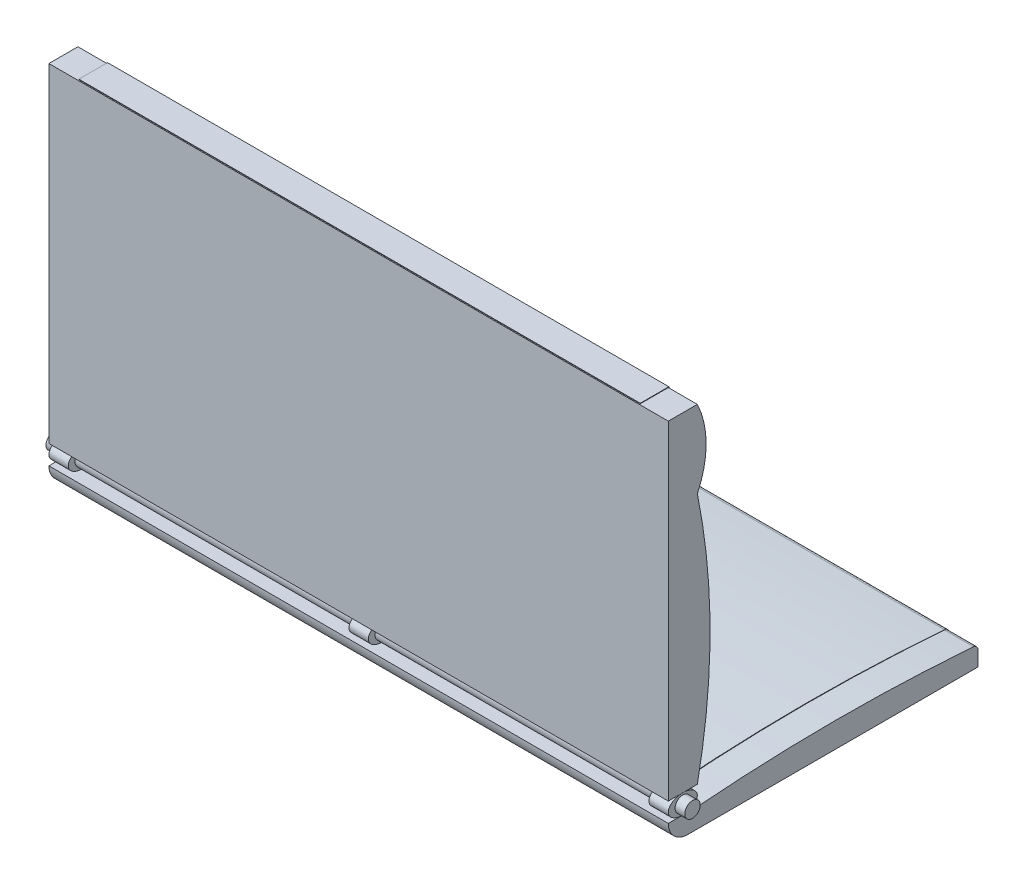
from build123d import *

# Parameters (mm, degrees)
SKETCH2_W            = 812.8
SKETCH2_H            = 406.4
BOSS_EXTRUDE1_DEPTH  = 25.4
BOSS_EXTRUDE2_START  = 25.4
SKETCH3_W            = 812.8
SKETCH3_H            = 38.1
BOSS_EXTRUDE2_DEPTH  = 431.8
SKETCH4_RX           = 19.05
SKETCH4_RY           = 12.7
BOSS_EXTRUDE3_DEPTH  = 25.4
SKETCH6_RX           = 19.05
SKETCH6_RY           = 12.7
BOSS_EXTRUDE4_DEPTH  = 25.4
BOSS_EXTRUDE5_START  = -419.1
SKETCH7_RX           = 19.05
SKETCH7_RY           = 12.7
BOSS_EXTRUDE5_DEPTH  = 25.4
BOSS_EXTRUDE6_START  = 12.7
SKETCH8_R            = 10.16
BOSS_EXTRUDE6_DEPTH  = 838.2
BOSS_EXTRUDE7_DEPTH  = 812.8
BOSS_EXTRUDE8_DEPTH  = 812.8
FILLET1_R            = 25.4
FILLET2_R            = 6.35
BOSS_EXTRUDE10_START = -38.1
BOSS_EXTRUDE10_DEPTH = 736.6
BOSS_EXTRUDE12_START = -38.1
BOSS_EXTRUDE12_DEPTH = 736.6
BOSS_EXTRUDE13_DEPTH = 6.35


with BuildPart() as part:
    # Sketch2 → Boss-Extrude1 (new body)
    with BuildSketch(Plane(origin=(0, 0, 0), x_dir=(1, 0, 0), z_dir=(0, 1, 0))):
        Rectangle(SKETCH2_W, SKETCH2_H)
    extrude(amount=BOSS_EXTRUDE1_DEPTH)

    # Sketch9 → Boss-Extrude7 (add)
    with BuildSketch(Plane.ZY.offset(406.4)):
        with BuildLine():
            Line((165.1, 25.4), (165.1, 0))
            Line((165.1, 0), (-203.2, 0))
            Line((-203.2, 0), (-203.2, 25.4))
            ThreePointArc((-203.2, 25.4), (-19.05, 32.854676191), (165.1, 25.4))
        make_face()
    extrude(amount=-BOSS_EXTRUDE7_DEPTH)

    # Fillet1
    fillet1_edges = [part.edges().sort_by_distance(p)[0] for p in [
        (0, 0, 203.2),
    ]]
    fillet(fillet1_edges, radius=FILLET1_R - 0.0001)  # a hair under: the kernel refuses the full size

    # Fillet2
    fillet2_edges = [part.edges().sort_by_distance(p)[0] for p in [
        (0, 25.4, -203.2),
    ]]
    fillet(fillet2_edges, radius=FILLET2_R)

    # Sketch13 → Boss-Extrude13 (add)
    with BuildSketch(Plane.XZ):
        Polygon((0, 0), (3.987974883, 0), (0, 5.287973751), align=None)
    extrude(amount=BOSS_EXTRUDE13_DEPTH)


with BuildPart() as body_2:
    # Sketch3 → Boss-Extrude2 (new body)
    with BuildSketch(Plane(origin=(0, 25.4, 0), x_dir=(1, 0, 0), z_dir=(0, 1, 0)).offset(BOSS_EXTRUDE2_START)):
        with Locations((0, -184.15)):
            Rectangle(SKETCH3_W, SKETCH3_H)
    extrude(amount=BOSS_EXTRUDE2_DEPTH)

    # Sketch10 → Boss-Extrude8 (add)
    with BuildSketch(Plane.ZY.offset(406.4)):
        with BuildLine():
            Line((165.1, 381), (165.1, 482.6))
            ThreePointArc((165.1, 482.6), (153.536753819, 431.8), (165.1, 381))
        make_face()
        with BuildLine():
            Line((165.1, 50.8), (165.1, 381))
            ThreePointArc((165.1, 381), (148.3957637, 215.9), (165.1, 50.8))
        make_face()
    extrude(amount=-BOSS_EXTRUDE8_DEPTH)


with BuildPart() as body_3:
    # Sketch4 → Boss-Extrude3 (new body)
    with BuildSketch(Plane(origin=(406.4, 0, 0), x_dir=(0, 0, -1), z_dir=(1, 0, 0))):
        with Locations(Location((-184.15, 38.1), (0, 0, 180))):
            Ellipse(SKETCH4_RX, SKETCH4_RY)
    extrude(amount=-BOSS_EXTRUDE3_DEPTH)



with BuildPart() as body_4:
    # Sketch6 → Boss-Extrude4 (new body)
    with BuildSketch(Plane.ZY.offset(406.4)):
        with Locations(Location((184.15, 38.1), (0, 0, 0))):
            Ellipse(SKETCH6_RX, SKETCH6_RY)
    extrude(amount=-BOSS_EXTRUDE4_DEPTH)


with BuildPart() as body_5:
    # Sketch7 → Boss-Extrude5 (new body)
    with BuildSketch(Plane(origin=(406.4, 0, 0), x_dir=(0, 0, -1), z_dir=(1, 0, 0)).offset(BOSS_EXTRUDE5_START)):
        with Locations(Location((-184.15, 38.1), (0, 0, 180))):
            Ellipse(SKETCH7_RX, SKETCH7_RY)
    extrude(amount=BOSS_EXTRUDE5_DEPTH)


with BuildPart() as body_3_1:
    add(body_3.part)

    add(body_4.part)  # Boss-Extrude6 merges body 4

    add(body_5.part)  # Boss-Extrude6 merges body 5
    # Sketch8 → Boss-Extrude6 (add)
    with BuildSketch(Plane(origin=(406.4, 0, 0), x_dir=(0, 0, -1), z_dir=(1, 0, 0)).offset(BOSS_EXTRUDE6_START)):
        with Locations((-184.15, 38.1)):
            Circle(SKETCH8_R)
    extrude(amount=-BOSS_EXTRUDE6_DEPTH)


with BuildPart() as body_4_2:
    # Sketch11 → Boss-Extrude10 (new body)
    with BuildSketch(Plane.ZY.offset(406.4).offset(BOSS_EXTRUDE10_START)):
        with BuildLine():
            Line((201.93, 482.6), (201.93, 483.235))
            Line((201.93, 483.235), (164.338, 483.235))
            ThreePointArc((164.338, 483.235), (152.564413358, 431.87154481), (164.338, 380.50808962))
            ThreePointArc((164.338, 380.50808962), (146.298542367, 215.341518423), (164.338, 50.174947227))
            Line((164.338, 50.174947227), (184.15, 50.8))
            Line((184.15, 50.8), (201.93, 50.8))
            Line((201.93, 50.8), (201.93, 482.6))
        make_face()
    extrude(amount=-BOSS_EXTRUDE10_DEPTH)


with BuildPart() as body_5_2:
    # Sketch12 → Boss-Extrude12 (new body)
    with BuildSketch(Plane.ZY.offset(406.4).offset(BOSS_EXTRUDE12_START)):
        with BuildLine():
            Line((-203.2, 0.419933844), (-203.472301364, 0.419933844))
            Line((-203.472301364, 0.419933844), (-203.472301364, 19.515665351))
            ThreePointArc((-203.472301364, 19.515665351), (-201.774803561, 24.099268204), (-197.333394693, 26.140052656))
            ThreePointArc((-197.333394693, 26.140052656), (-16.18943201, 33.540467261), (164.954530674, 26.140052656))
            Line((164.954530674, 26.140052656), (184.15, 25.4))
            Line((184.15, 25.4), (202.826490768, 25.4))
            ThreePointArc((202.826490768, 25.4), (195.208376954, 7.934417267), (177.69795785, 0.419933844))
            Line((177.69795785, 0.419933844), (-203.2, 0.419933844))
        make_face()
    extrude(amount=-BOSS_EXTRUDE12_DEPTH)


solid = Compound([part.part, body_2.part, body_3_1.part, body_4_2.part, body_5_2.part])
